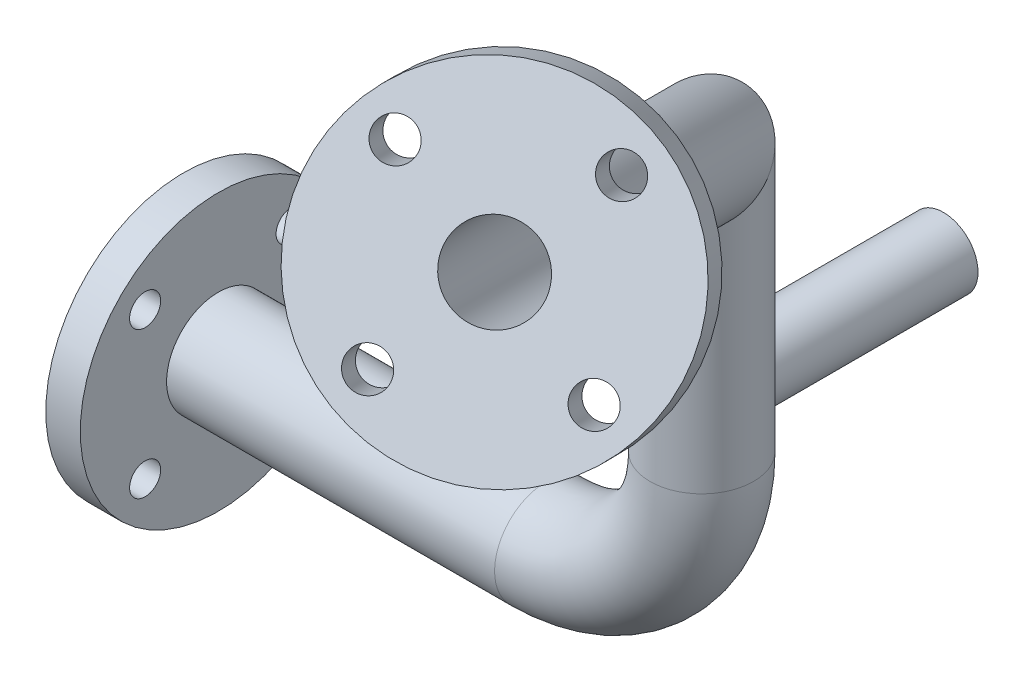
from build123d import *

# Parameters (mm, degrees)
SWEEP_2_PROFILE_R    = 15
SWEEP_6_PROFILE_R    = 15
SKETCH_7_R           = 40
EXTRUDE_2_DEPTH      = 10
SKETCH_8_R           = 4.5
CUT_EXTRUDE_1_DEPTH  = 357.575052533
SWEEP_START          = 287.981272568
SWEEP_8_OUTLINE_R    = 45
SWEEP_8_DEPTH        = 12.094233032
SWEEP_START_2        = 300
SWEEP_8_2_OUTLINE_W  = 93
SWEEP_8_2_OUTLINE_H  = 93
SWEEP_8_2_DEPTH      = 1
EXTRUDE_3_REACH      = 435.125
EXTRUDE_3_END_RADIUS = 15
SKETCH_15_R          = 10
SWEEP_2_2_PROFILE_R  = 12
SWEEP_4_PROFILE_R    = 12
SKETCH_19_R          = 7
CUT_EXTRUDE_2_DEPTH  = 70
SWEEP_14_PROFILE_R   = 5.5
SWEEP_16_PROFILE_R   = 5.5
SWEEP_18_PROFILE_R   = 5.5
SWEEP_20_PROFILE_R   = 5.5


with BuildPart() as part:
    # Sweep 2: sweep along a path in 草图1
    with BuildLine(Plane.XY) as sweep_2_path:
        Line((0, 0), (105, 0))
        ThreePointArc((105, 0), (136.819805153, 13.180194847), (150, 45))
        Line((150, 45), (150, 77.56))
    # Sweep 2 profile (on start of the path) → Sweep 2 (sweep)
    with BuildSketch(Plane(origin=(0, 0, 0), x_dir=(0, 0, 1), z_dir=(1, 0, 0))):
        Circle(SWEEP_2_PROFILE_R)
    sweep(path=sweep_2_path.line)

    # 扫描6: sweep along a curve in space
    with BuildLine() as sweep_6_path:
        Line((150, 50, 0), (150, 120, 0))
        Line((150, 120, 0), (230, 200, 140))
    # 扫描6 profile (on start of the path) → 扫描6 (sweep)
    with BuildSketch(Plane(origin=(150, 50, 0), x_dir=(0, 0, 1), z_dir=(0, 1, 0))):
        Circle(SWEEP_6_PROFILE_R)
    sweep(path=sweep_6_path.line, transition=Transition.RIGHT)

    # 草图7 → 凸台-拉伸2 (add)
    with BuildSketch(Plane(origin=(0, 0, 0), x_dir=(0, 0, -1), z_dir=(1, 0, 0))):
        Circle(SKETCH_7_R)
    extrude(amount=EXTRUDE_2_DEPTH)

    # 草图8 → 切除-拉伸1 (cut, through all)
    with BuildSketch(Plane(origin=(0, 0, 0), x_dir=(0, 0, -1), z_dir=(1, 0, 0))):
        with Locations((-21.213203, 21.213203)):
            Circle(SKETCH_8_R)
        with Locations((21.213203, 21.213203)):
            Circle(SKETCH_8_R)
        with Locations((21.213203, -21.213203)):
            Circle(SKETCH_8_R)
        with Locations((-21.213203, -21.213203)):
            Circle(SKETCH_8_R)
    extrude(amount=CUT_EXTRUDE_1_DEPTH, mode=Mode.SUBTRACT)

    # 扫描8: read off the stored shape, not the designer's step
    # 扫描8 outline → 扫描8 (add)
    with BuildSketch(Plane(origin=(0, 0, 0), x_dir=(0.8956998912049878, -0.22074548276362646, -0.38599629108946926), z_dir=(0.4446590883984862, 0.4446590883984862, 0.7775323724509833)).offset(SWEEP_START)):
        with Locations((107.822397672, 104.113222554)):
            Circle(SWEEP_8_OUTLINE_R)
    extrude(amount=SWEEP_8_DEPTH)

    # Sweep 8 2 outline → Sweep 8 2 (cut)
    with BuildSketch(Plane(origin=(0, 0, 0), x_dir=(0.8958064164776169, -0.2205061948252594, -0.3858858409442036), z_dir=(0.4444444444444439, 0.4444444444444449, 0.7777777777777779)).offset(SWEEP_START_2)):
        with Locations((107.5, 104.5)):
            Rectangle(SWEEP_8_2_OUTLINE_W, SWEEP_8_2_OUTLINE_H)
    extrude(amount=SWEEP_8_2_DEPTH, mode=Mode.SUBTRACT)

    # 凸台-拉伸3: up to this cylinder (the profile starts outside it)
    extrude_3_end = Plane(origin=(150, 60, 0), z_dir=(0, 1, 0)) * Cylinder(EXTRUDE_3_END_RADIUS, 901.25, mode=Mode.PRIVATE)
    # 草图15 → 凸台-拉伸3 (add, up to the surface)
    with BuildSketch(Plane.XY.offset(-70), mode=Mode.PRIVATE) as extrude_3_sk1:
        with Locations(Location((150, 60, 0), (0, 0, 180))):
            Circle(SKETCH_15_R)
    extrude_3_tool1 = extrude(extrude_3_sk1.sketch, amount=EXTRUDE_3_REACH, mode=Mode.PRIVATE) - extrude_3_end
    add(extrude_3_tool1.solids().sort_by_distance((150, 60, -70))[0])

    # Sweep 2 2: sweep along a path in 草图16
    with BuildLine(Plane.XY) as sweep_2_2_path:
        Line((-10, 0), (105, 0))
        ThreePointArc((105, 0), (136.819805153, 13.180194847), (150, 45))
        Line((150, 45), (150, 77.56))
    # Sweep 2 2 profile (on start of the path) → Sweep 2 2 (sweep, cut)
    with BuildSketch(Plane(origin=(-10, 0, 0), x_dir=(0, 0, 1), z_dir=(1, 0, 0))):
        Circle(SWEEP_2_2_PROFILE_R)
    sweep(path=sweep_2_2_path.line, mode=Mode.SUBTRACT)

    # 切除-扫描4: sweep along a curve in space
    with BuildLine() as sweep_4_path:
        Line((150, 50, 0), (150, 120, 0))
        Line((150, 120, 0), (236.67, 206.67, 151.67))
    # 切除-扫描4 profile (on start of the path) → 切除-扫描4 (sweep, cut)
    with BuildSketch(Plane(origin=(150, 50, 0), x_dir=(0, 0, 1), z_dir=(0, 1, 0))):
        Circle(SWEEP_4_PROFILE_R)
    sweep(path=sweep_4_path.line, transition=Transition.RIGHT, mode=Mode.SUBTRACT)

    # 草图19 → 切除-拉伸2 (cut)
    with BuildSketch(Plane.XY.offset(-70)):
        with Locations(Location((150, 60, 0), (0, 0, 180))):
            Circle(SKETCH_19_R)
    extrude(amount=CUT_EXTRUDE_2_DEPTH, mode=Mode.SUBTRACT)

    # 切除-扫描14: sweep along a curve in space
    with BuildLine() as sweep_14_path:
        Line((262.842, 185.134, 149.017), (249.508, 171.8, 125.683))
    # 切除-扫描14 profile (on start of the path) → 切除-扫描14 (sweep, cut)
    with BuildSketch(Plane(origin=(262.842, 185.134, 149.017), x_dir=(-0.8682385624984269, 0, 0.4961469526165259), z_dir=(-0.4444502055235574, -0.4444502055235574, -0.7777711936168215))):
        Circle(SWEEP_14_PROFILE_R)
    sweep(path=sweep_14_path.line, mode=Mode.SUBTRACT)

    # 切除-扫描16: sweep along a curve in space
    with BuildLine() as sweep_16_path:
        Line((252.241, 228.2, 130.462), (238.907, 214.866, 107.128))
    # 切除-扫描16 profile (on start of the path) → 切除-扫描16 (sweep, cut)
    with BuildSketch(Plane(origin=(252.241, 228.2, 130.462), x_dir=(-0.868238562498427, 0, 0.4961469526165257), z_dir=(-0.4444502055235573, -0.4444502055235573, -0.7777711936168217))):
        Circle(SWEEP_16_PROFILE_R)
    sweep(path=sweep_16_path.line, mode=Mode.SUBTRACT)

    # 切除-扫描18: sweep along a curve in space
    with BuildLine() as sweep_18_path:
        Line((210.492, 228.2, 154.317), (197.158, 214.866, 130.983))
    # 切除-扫描18 profile (on start of the path) → 切除-扫描18 (sweep, cut)
    with BuildSketch(Plane(origin=(210.492, 228.2, 154.317), x_dir=(-0.8682385624984262, 0, 0.496146952616527), z_dir=(-0.44445020552355863, -0.44445020552355674, -0.7777711936168212))):
        Circle(SWEEP_18_PROFILE_R)
    sweep(path=sweep_18_path.line, mode=Mode.SUBTRACT)

    # 切除-扫描20: sweep along a curve in space
    with BuildLine() as sweep_20_path:
        Line((221.093, 185.134, 172.872), (207.759, 171.8, 149.538))
    # 切除-扫描20 profile (on start of the path) → 切除-扫描20 (sweep, cut)
    with BuildSketch(Plane(origin=(221.093, 185.134, 172.872), x_dir=(-0.8682385624984266, 0, 0.4961469526165266), z_dir=(-0.4444502055235583, -0.44445020552355635, -0.7777711936168216))):
        Circle(SWEEP_20_PROFILE_R)
    sweep(path=sweep_20_path.line, mode=Mode.SUBTRACT)


solid = part.part
